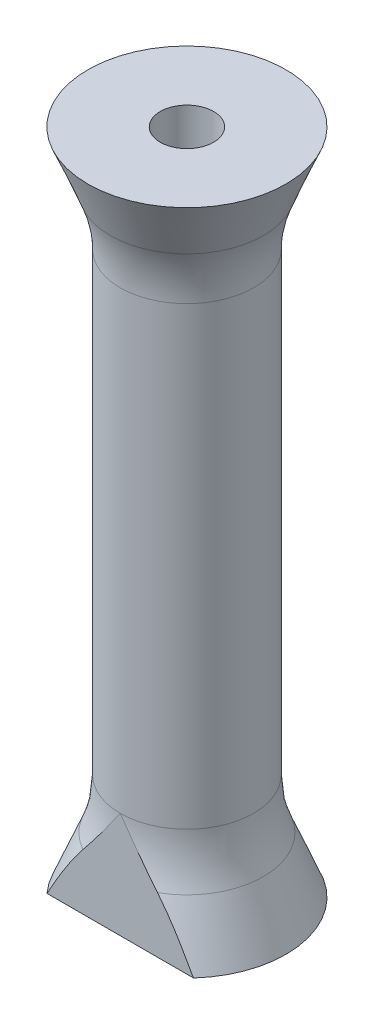
from build123d import *

# Parameters (mm, degrees)
SKETCH1_R           = 6.35
SKETCH1_R_2         = 2.54
BOSS_EXTRUDE1_DEPTH = 63.5
SKETCH2_R           = 9.525
SKETCH2_R_2         = 2.54
BOSS_EXTRUDE2_DEPTH = 7.62
CHAMFER1_SIZE       = 7.85840076
CHAMFER1_SIZE_2     = 3.175
FILLET1_R           = 12.7
BOSS_EXTRUDE3_START = -7.62
SKETCH3_R           = 9.525
SKETCH3_R_2         = 2.54
BOSS_EXTRUDE3_DEPTH = 7.62
CHAMFER2_SIZE       = 3.175
CHAMFER2_SIZE_2     = 7.85840076
FILLET2_R           = 12.7
CUT_EXTRUDE1_START  = 6.35
SKETCH4_W           = 29.198575266
SKETCH4_H           = 42.680388974
CUT_EXTRUDE1_DEPTH  = 59.53489827


with BuildPart() as part:
    # Sketch1 → Boss-Extrude1 (new body)
    with BuildSketch(Plane(origin=(0, 0, 0), x_dir=(1, 0, 0), z_dir=(0, 1, 0))):
        with Locations(Location((0, 0, 0), (0, 0, 270))):
            Circle(SKETCH1_R)
        with Locations(Location((0, 0, 0), (0, 0, 270))):
            Circle(SKETCH1_R_2, mode=Mode.SUBTRACT)
    extrude(amount=BOSS_EXTRUDE1_DEPTH)

    # Sketch2 → Boss-Extrude2 (add)
    with BuildSketch(Plane(origin=(0, 0, 0), x_dir=(-1, 0, 0), z_dir=(0, -1, 0))):
        with Locations(Location((0, 0, 0), (0, 0, 90))):
            Circle(SKETCH2_R)
        with Locations(Location((0, 0, 0), (0, 0, 270))):
            Circle(SKETCH2_R_2, mode=Mode.SUBTRACT)
    extrude(amount=-BOSS_EXTRUDE2_DEPTH)

    # Chamfer1
    # the kernel refuses this chamfer: 7.85840076, 3.175 mm, written as the material it takes off along each edge
    with BuildSketch(Plane(origin=(0, 7.62, 0), x_dir=(0, 0, -1), z_dir=(-1, 0, 0))) as chamfer1_piece_1:
        Polygon((9.525, CHAMFER1_SIZE), (9.525 - CHAMFER1_SIZE_2, 0), (9.525, 0), align=None)
    revolve(axis=Axis((0, 7.62, 0), (0, -1, 0)), mode=Mode.SUBTRACT)

    # Fillet1
    fillet1_edges = [part.edges().sort_by_distance(p)[0] for p in [
        (6.35, 7.62, 0),
    ]]
    fillet(fillet1_edges, radius=FILLET1_R)

    # Sketch3 → Boss-Extrude3 (add)
    with BuildSketch(Plane(origin=(0, 63.5, 0), x_dir=(1, 0, 0), z_dir=(0, 1, 0)).offset(BOSS_EXTRUDE3_START)):
        with Locations(Location((0, 0, 0), (0, 0, 270))):
            Circle(SKETCH3_R)
        with Locations(Location((0, 0, 0), (0, 0, 270))):
            Circle(SKETCH3_R_2, mode=Mode.SUBTRACT)
    extrude(amount=BOSS_EXTRUDE3_DEPTH)

    # Chamfer2
    # the kernel refuses this chamfer: 7.85840076, 3.175 mm, written as the material it takes off along each edge
    with BuildSketch(Plane(origin=(0, 55.88, 0), x_dir=(0, 0, 1), z_dir=(-1, 0, 0))) as chamfer2_piece_1_section:
        Polygon((9.525 - CHAMFER2_SIZE, 0), (9.525, CHAMFER2_SIZE_2), (9.525, 0), align=None)
    chamfer2_piece_1 = revolve(axis=Axis((0, 55.88, 0), (0, 1, 0)), mode=Mode.PRIVATE)
    chamfer2_piece_1 = chamfer2_piece_1 - Plane(origin=(0, 59.920436712, 0), x_dir=(0, 0, 1), z_dir=(0, -1, 0)) * Cylinder(6.35, 39, mode=Mode.PRIVATE)
    add(chamfer2_piece_1, mode=Mode.SUBTRACT)

    # Fillet2
    fillet2_edges = [part.edges().sort_by_distance(p)[0] for p in [
        (0, 55.88, -6.35),
    ]]
    fillet(fillet2_edges, radius=FILLET2_R)

    # Sketch4 → Cut-Extrude1 (cut, through all)
    with BuildSketch(Plane.XY.offset(CUT_EXTRUDE1_START)):
        with Locations((0, 16.627867716)):
            Rectangle(SKETCH4_W, SKETCH4_H)
    extrude(amount=CUT_EXTRUDE1_DEPTH, mode=Mode.SUBTRACT)


solid = part.part
